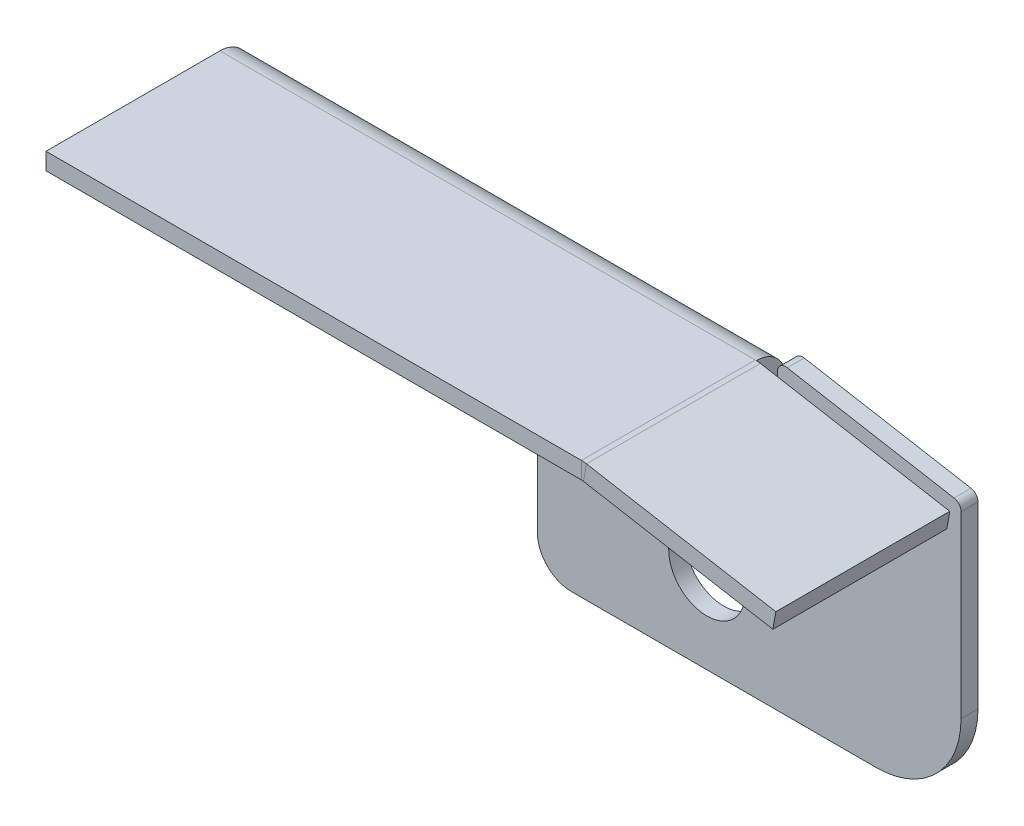
from build123d import *

# Parameters (mm, degrees)
BASIS_BLECH1_DEPTH             = 1
KANTE_LASCHE1_STRIP_W          = 5.4732
KANTE_LASCHE1_STRIP_H          = 1
KANTE_LASCHE1_STRIP_CUT_DEPTH  = 31.657436361
KANTE_LASCHE1_RELIEF_W         = 5.9732
KANTE_LASCHE1_RELIEF_H         = 0.5
KANTE_LASCHE1_RELIEF_CUT_DEPTH = 1
KANTE_LASCHE1_DEPTH            = 31.657436361
KANTE_LASCHE2_STRIP_CUT_DEPTH  = 10.2634
KANTE_LASCHE2_DEPTH            = 10.2634
VERRUNDUNG1_R                  = 0.5


# Sheet-metal steps are written as plain solids
with BuildPart() as part:
    # Skizze1 → Basis-Blech1 (new body)
    with BuildSketch(Plane.XY):
        with BuildLine():
            Line((-42, -8.5), (-42, -16.5))
            ThreePointArc((-42, -16.5), (-41.414213562, -17.914213562), (-40, -18.5))
            Line((-40, -18.5), (-22, -18.5))
            ThreePointArc((-22, -18.5), (-18.464466094, -17.035533906), (-17, -13.5))
            Line((-17, -13.5), (-17, -2.5))
            Line((-17, -2.5), (-28.342563639, -0.5))
            Line((-28.342563639, -0.5), (-60, -0.5))
            Line((-60, -0.5), (-60, -6.5))
            ThreePointArc((-60, -6.5), (-59.414213562, -7.914213562), (-58, -8.5))
            Line((-58, -8.5), (-42, -8.5))
        make_face()
        with BuildLine():
            Line((-29.75, -7.5), (-29.75, -13.5))
            ThreePointArc((-29.75, -13.5), (-32, -15.75), (-34.25, -13.5))
            Line((-34.25, -13.5), (-34.25, -7.5))
            ThreePointArc((-34.25, -7.5), (-32, -5.25), (-29.75, -7.5))
        make_face(mode=Mode.SUBTRACT)
    extrude(amount=BASIS_BLECH1_DEPTH)

    # Kante-Lasche1 strip (across the edge) → Kante-Lasche1 strip cut (cut)
    with BuildSketch(Plane(origin=(-28.342563639, -0.5, 1), x_dir=(0, -1, 0), z_dir=(-1, 0, 0))):
        with Locations((-1, -0.5)):
            Rectangle(KANTE_LASCHE1_STRIP_W, KANTE_LASCHE1_STRIP_H)
    extrude(amount=KANTE_LASCHE1_STRIP_CUT_DEPTH, mode=Mode.SUBTRACT)

    # Kante-Lasche1 relief (on the sheet) → Kante-Lasche1 relief cut (cut)
    with BuildSketch(Plane(origin=(-28.342563639, -2.2366, 1), x_dir=(0, -1, 0), z_dir=(0, 0, 1))):
        with Locations((-2.4866, 0.25)):
            Rectangle(KANTE_LASCHE1_RELIEF_W, KANTE_LASCHE1_RELIEF_H)
    extrude(amount=-KANTE_LASCHE1_RELIEF_CUT_DEPTH, mode=Mode.SUBTRACT)

    # Kante-Lasche1 section (across the edge) → Kante-Lasche1 (add)
    with BuildSketch(Plane(origin=(-28.342563639, -0.5, 1), x_dir=(0, -1, 0), z_dir=(-1, 0, 0))):
        with BuildLine():
            Line((0, 0.7366), (0, 11))
            Line((0, 11), (1, 11))
            Line((1, 11), (1, 0.7366))
            ThreePointArc((1, 0.7366), (1.215745145, 0.215745145), (1.7366, 0))
            Line((1.7366, 0), (1.7366, -1))
            ThreePointArc((1.7366, -1), (0.508638364, -0.491361636), (0, 0.7366))
        make_face()
    extrude(amount=KANTE_LASCHE1_DEPTH)

    # Kante-Lasche2 strip (across the edge) → Kante-Lasche2 strip cut (cut)
    with BuildSketch(Plane(origin=(-28.342563639, -1.5, 1.7366), x_dir=(-0.1736481776669236, -0.9848077530122092, 3.3156835934820577e-15), z_dir=(0, 0, 1))):
        Polygon((-1.92402835, 5.152936518), (-0.973617144, -0.237113276), (0.011190609, -0.063465098), (-0.939220597, 5.326584696), align=None)
    extrude(amount=KANTE_LASCHE2_STRIP_CUT_DEPTH, mode=Mode.SUBTRACT)

    # Kante-Lasche2 section (across the edge) → Kante-Lasche2 (add)
    with BuildSketch(Plane(origin=(-28.342563639, -1.5, 1.7366), x_dir=(-0.1736481776669236, -0.9848077530122092, 3.3156835934820577e-15), z_dir=(0, 0, 1))):
        with BuildLine():
            Line((-1, 0.06444415), (-1, 11.412511336))
            Line((-1, 11.412511336), (0, 11.412511336))
            Line((0, 11.412511336), (0, 0.06444415))
            ThreePointArc((0, 0.06444415), (0.002802985, 0.000245229), (0.011190609, -0.063465098))
            Line((0.011190609, -0.063465098), (-0.973617144, -0.237113276))
            ThreePointArc((-0.973617144, -0.237113276), (-0.993391713, -0.086910513), (-1, 0.06444415))
        make_face()
    extrude(amount=KANTE_LASCHE2_DEPTH)

    # Verrundung1
    verrundung1_edges = [part.edges().sort_by_distance(p)[0] for p in [
        (-17, -2.5, 0.5),
        (-27.842563639, -0.58816349, 0.5),
    ]]
    fillet(verrundung1_edges, radius=VERRUNDUNG1_R)


solid = part.part
